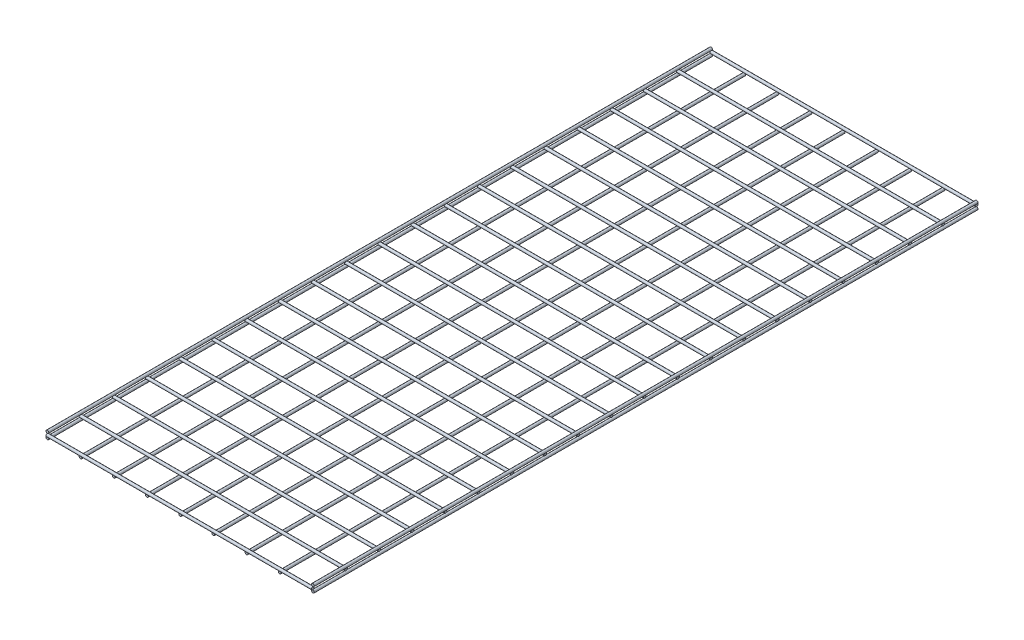
from build123d import *

# Parameters (mm, degrees)
SKETCH1_R              = 3.175
BOSS_EXTRUDE1_DEPTH    = 1524
BOSS_EXTRUDE1_2_DEPTH  = 1524
BOSS_EXTRUDE1_3_DEPTH  = 1524
BOSS_EXTRUDE1_4_DEPTH  = 1524
BOSS_EXTRUDE1_5_DEPTH  = 1524
BOSS_EXTRUDE1_6_DEPTH  = 1524
BOSS_EXTRUDE1_7_DEPTH  = 1524
BOSS_EXTRUDE1_8_DEPTH  = 1524
BOSS_EXTRUDE1_9_DEPTH  = 1524
BOSS_EXTRUDE1_10_DEPTH = 1524
BOSS_EXTRUDE1_11_DEPTH = 1524
SKETCH2_R              = 3.175
BOSS_EXTRUDE2_DEPTH    = 609.6
BOSS_EXTRUDE2_2_DEPTH  = 609.6
BOSS_EXTRUDE2_3_DEPTH  = 609.6
BOSS_EXTRUDE2_4_DEPTH  = 609.6
BOSS_EXTRUDE2_5_DEPTH  = 609.6
BOSS_EXTRUDE2_6_DEPTH  = 609.6
BOSS_EXTRUDE2_7_DEPTH  = 609.6
BOSS_EXTRUDE2_8_DEPTH  = 609.6
BOSS_EXTRUDE2_9_DEPTH  = 609.6
BOSS_EXTRUDE2_10_DEPTH = 609.6
BOSS_EXTRUDE2_11_DEPTH = 609.6
BOSS_EXTRUDE2_12_DEPTH = 609.6
BOSS_EXTRUDE2_13_DEPTH = 609.6
BOSS_EXTRUDE2_14_DEPTH = 609.6
BOSS_EXTRUDE2_15_DEPTH = 609.6
BOSS_EXTRUDE2_16_DEPTH = 609.6
BOSS_EXTRUDE2_17_DEPTH = 609.6
BOSS_EXTRUDE2_18_DEPTH = 609.6
BOSS_EXTRUDE2_19_DEPTH = 609.6
BOSS_EXTRUDE2_20_DEPTH = 609.6
BOSS_EXTRUDE2_21_DEPTH = 609.6


with BuildPart() as part:
    # Sketch1 → Boss-Extrude1 (new body)
    with BuildSketch(Plane.XY):
        Circle(SKETCH1_R)
    extrude(amount=BOSS_EXTRUDE1_DEPTH)


with BuildPart() as body_2:
    # Sketch1 → Boss-Extrude1 2 (new body)
    with BuildSketch(Plane.XY):
        with Locations((0, 12.7)):
            Circle(SKETCH1_R)
    extrude(amount=BOSS_EXTRUDE1_2_DEPTH)


with BuildPart() as body_3:
    # Sketch1 → Boss-Extrude1 3 (new body)
    with BuildSketch(Plane.XY):
        with Locations((76.2, 0)):
            Circle(SKETCH1_R)
    extrude(amount=BOSS_EXTRUDE1_3_DEPTH)


with BuildPart() as body_4:
    # Sketch1 → Boss-Extrude1 4 (new body)
    with BuildSketch(Plane.XY):
        with Locations((152.4, 0)):
            Circle(SKETCH1_R)
    extrude(amount=BOSS_EXTRUDE1_4_DEPTH)


with BuildPart() as body_5:
    # Sketch1 → Boss-Extrude1 5 (new body)
    with BuildSketch(Plane.XY):
        with Locations((228.6, 0)):
            Circle(SKETCH1_R)
    extrude(amount=BOSS_EXTRUDE1_5_DEPTH)


with BuildPart() as body_6:
    # Sketch1 → Boss-Extrude1 6 (new body)
    with BuildSketch(Plane.XY):
        with Locations((304.8, 0)):
            Circle(SKETCH1_R)
    extrude(amount=BOSS_EXTRUDE1_6_DEPTH)


with BuildPart() as body_7:
    # Sketch1 → Boss-Extrude1 7 (new body)
    with BuildSketch(Plane.XY):
        with Locations((381, 0)):
            Circle(SKETCH1_R)
    extrude(amount=BOSS_EXTRUDE1_7_DEPTH)


with BuildPart() as body_8:
    # Sketch1 → Boss-Extrude1 8 (new body)
    with BuildSketch(Plane.XY):
        with Locations((457.2, 0)):
            Circle(SKETCH1_R)
    extrude(amount=BOSS_EXTRUDE1_8_DEPTH)


with BuildPart() as body_9:
    # Sketch1 → Boss-Extrude1 9 (new body)
    with BuildSketch(Plane.XY):
        with Locations((533.4, 0)):
            Circle(SKETCH1_R)
    extrude(amount=BOSS_EXTRUDE1_9_DEPTH)


with BuildPart() as body_10:
    # Sketch1 → Boss-Extrude1 10 (new body)
    with BuildSketch(Plane.XY):
        with Locations((609.6, 0)):
            Circle(SKETCH1_R)
    extrude(amount=BOSS_EXTRUDE1_10_DEPTH)


with BuildPart() as body_11:
    # Sketch1 → Boss-Extrude1 11 (new body)
    with BuildSketch(Plane.XY):
        with Locations((609.6, 12.7)):
            Circle(SKETCH1_R)
    extrude(amount=BOSS_EXTRUDE1_11_DEPTH)


with BuildPart() as body_12:
    # Sketch2 → Boss-Extrude2 (new body)
    with BuildSketch(Plane(origin=(0, 0, 0), x_dir=(0, 0, -1), z_dir=(1, 0, 0))):
        with Locations((0, 6.35)):
            Circle(SKETCH2_R)
    extrude(amount=BOSS_EXTRUDE2_DEPTH)


with BuildPart() as body_13:
    # Sketch2 → Boss-Extrude2 2 (new body)
    with BuildSketch(Plane(origin=(0, 0, 0), x_dir=(0, 0, -1), z_dir=(1, 0, 0))):
        with Locations((-76.2, 6.35)):
            Circle(SKETCH2_R)
    extrude(amount=BOSS_EXTRUDE2_2_DEPTH)


with BuildPart() as body_14:
    # Sketch2 → Boss-Extrude2 3 (new body)
    with BuildSketch(Plane(origin=(0, 0, 0), x_dir=(0, 0, -1), z_dir=(1, 0, 0))):
        with Locations((-152.4, 6.35)):
            Circle(SKETCH2_R)
    extrude(amount=BOSS_EXTRUDE2_3_DEPTH)


with BuildPart() as body_15:
    # Sketch2 → Boss-Extrude2 4 (new body)
    with BuildSketch(Plane(origin=(0, 0, 0), x_dir=(0, 0, -1), z_dir=(1, 0, 0))):
        with Locations((-228.6, 6.35)):
            Circle(SKETCH2_R)
    extrude(amount=BOSS_EXTRUDE2_4_DEPTH)


with BuildPart() as body_16:
    # Sketch2 → Boss-Extrude2 5 (new body)
    with BuildSketch(Plane(origin=(0, 0, 0), x_dir=(0, 0, -1), z_dir=(1, 0, 0))):
        with Locations((-304.8, 6.35)):
            Circle(SKETCH2_R)
    extrude(amount=BOSS_EXTRUDE2_5_DEPTH)


with BuildPart() as body_17:
    # Sketch2 → Boss-Extrude2 6 (new body)
    with BuildSketch(Plane(origin=(0, 0, 0), x_dir=(0, 0, -1), z_dir=(1, 0, 0))):
        with Locations((-381, 6.35)):
            Circle(SKETCH2_R)
    extrude(amount=BOSS_EXTRUDE2_6_DEPTH)


with BuildPart() as body_18:
    # Sketch2 → Boss-Extrude2 7 (new body)
    with BuildSketch(Plane(origin=(0, 0, 0), x_dir=(0, 0, -1), z_dir=(1, 0, 0))):
        with Locations((-457.2, 6.35)):
            Circle(SKETCH2_R)
    extrude(amount=BOSS_EXTRUDE2_7_DEPTH)


with BuildPart() as body_19:
    # Sketch2 → Boss-Extrude2 8 (new body)
    with BuildSketch(Plane(origin=(0, 0, 0), x_dir=(0, 0, -1), z_dir=(1, 0, 0))):
        with Locations((-533.4, 6.35)):
            Circle(SKETCH2_R)
    extrude(amount=BOSS_EXTRUDE2_8_DEPTH)


with BuildPart() as body_20:
    # Sketch2 → Boss-Extrude2 9 (new body)
    with BuildSketch(Plane(origin=(0, 0, 0), x_dir=(0, 0, -1), z_dir=(1, 0, 0))):
        with Locations((-609.6, 6.35)):
            Circle(SKETCH2_R)
    extrude(amount=BOSS_EXTRUDE2_9_DEPTH)


with BuildPart() as body_21:
    # Sketch2 → Boss-Extrude2 10 (new body)
    with BuildSketch(Plane(origin=(0, 0, 0), x_dir=(0, 0, -1), z_dir=(1, 0, 0))):
        with Locations((-685.8, 6.35)):
            Circle(SKETCH2_R)
    extrude(amount=BOSS_EXTRUDE2_10_DEPTH)


with BuildPart() as body_22:
    # Sketch2 → Boss-Extrude2 11 (new body)
    with BuildSketch(Plane(origin=(0, 0, 0), x_dir=(0, 0, -1), z_dir=(1, 0, 0))):
        with Locations((-762, 6.35)):
            Circle(SKETCH2_R)
    extrude(amount=BOSS_EXTRUDE2_11_DEPTH)


with BuildPart() as body_23:
    # Sketch2 → Boss-Extrude2 12 (new body)
    with BuildSketch(Plane(origin=(0, 0, 0), x_dir=(0, 0, -1), z_dir=(1, 0, 0))):
        with Locations((-838.2, 6.35)):
            Circle(SKETCH2_R)
    extrude(amount=BOSS_EXTRUDE2_12_DEPTH)


with BuildPart() as body_24:
    # Sketch2 → Boss-Extrude2 13 (new body)
    with BuildSketch(Plane(origin=(0, 0, 0), x_dir=(0, 0, -1), z_dir=(1, 0, 0))):
        with Locations((-914.4, 6.35)):
            Circle(SKETCH2_R)
    extrude(amount=BOSS_EXTRUDE2_13_DEPTH)


with BuildPart() as body_25:
    # Sketch2 → Boss-Extrude2 14 (new body)
    with BuildSketch(Plane(origin=(0, 0, 0), x_dir=(0, 0, -1), z_dir=(1, 0, 0))):
        with Locations((-990.6, 6.35)):
            Circle(SKETCH2_R)
    extrude(amount=BOSS_EXTRUDE2_14_DEPTH)


with BuildPart() as body_26:
    # Sketch2 → Boss-Extrude2 15 (new body)
    with BuildSketch(Plane(origin=(0, 0, 0), x_dir=(0, 0, -1), z_dir=(1, 0, 0))):
        with Locations((-1066.8, 6.35)):
            Circle(SKETCH2_R)
    extrude(amount=BOSS_EXTRUDE2_15_DEPTH)


with BuildPart() as body_27:
    # Sketch2 → Boss-Extrude2 16 (new body)
    with BuildSketch(Plane(origin=(0, 0, 0), x_dir=(0, 0, -1), z_dir=(1, 0, 0))):
        with Locations((-1143, 6.35)):
            Circle(SKETCH2_R)
    extrude(amount=BOSS_EXTRUDE2_16_DEPTH)


with BuildPart() as body_28:
    # Sketch2 → Boss-Extrude2 17 (new body)
    with BuildSketch(Plane(origin=(0, 0, 0), x_dir=(0, 0, -1), z_dir=(1, 0, 0))):
        with Locations((-1219.2, 6.35)):
            Circle(SKETCH2_R)
    extrude(amount=BOSS_EXTRUDE2_17_DEPTH)


with BuildPart() as body_29:
    # Sketch2 → Boss-Extrude2 18 (new body)
    with BuildSketch(Plane(origin=(0, 0, 0), x_dir=(0, 0, -1), z_dir=(1, 0, 0))):
        with Locations((-1295.4, 6.35)):
            Circle(SKETCH2_R)
    extrude(amount=BOSS_EXTRUDE2_18_DEPTH)


with BuildPart() as body_30:
    # Sketch2 → Boss-Extrude2 19 (new body)
    with BuildSketch(Plane(origin=(0, 0, 0), x_dir=(0, 0, -1), z_dir=(1, 0, 0))):
        with Locations((-1371.6, 6.35)):
            Circle(SKETCH2_R)
    extrude(amount=BOSS_EXTRUDE2_19_DEPTH)


with BuildPart() as body_31:
    # Sketch2 → Boss-Extrude2 20 (new body)
    with BuildSketch(Plane(origin=(0, 0, 0), x_dir=(0, 0, -1), z_dir=(1, 0, 0))):
        with Locations((-1447.8, 6.35)):
            Circle(SKETCH2_R)
    extrude(amount=BOSS_EXTRUDE2_20_DEPTH)


with BuildPart() as body_32:
    # Sketch2 → Boss-Extrude2 21 (new body)
    with BuildSketch(Plane(origin=(0, 0, 0), x_dir=(0, 0, -1), z_dir=(1, 0, 0))):
        with Locations((-1524, 6.35)):
            Circle(SKETCH2_R)
    extrude(amount=BOSS_EXTRUDE2_21_DEPTH)


solid = Compound([part.part, body_2.part, body_3.part, body_4.part, body_5.part, body_6.part, body_7.part, body_8.part, body_9.part, body_10.part, body_11.part, body_12.part, body_13.part, body_14.part, body_15.part, body_16.part, body_17.part, body_18.part, body_19.part, body_20.part, body_21.part, body_22.part, body_23.part, body_24.part, body_25.part, body_26.part, body_27.part, body_28.part, body_29.part, body_30.part, body_31.part, body_32.part])
